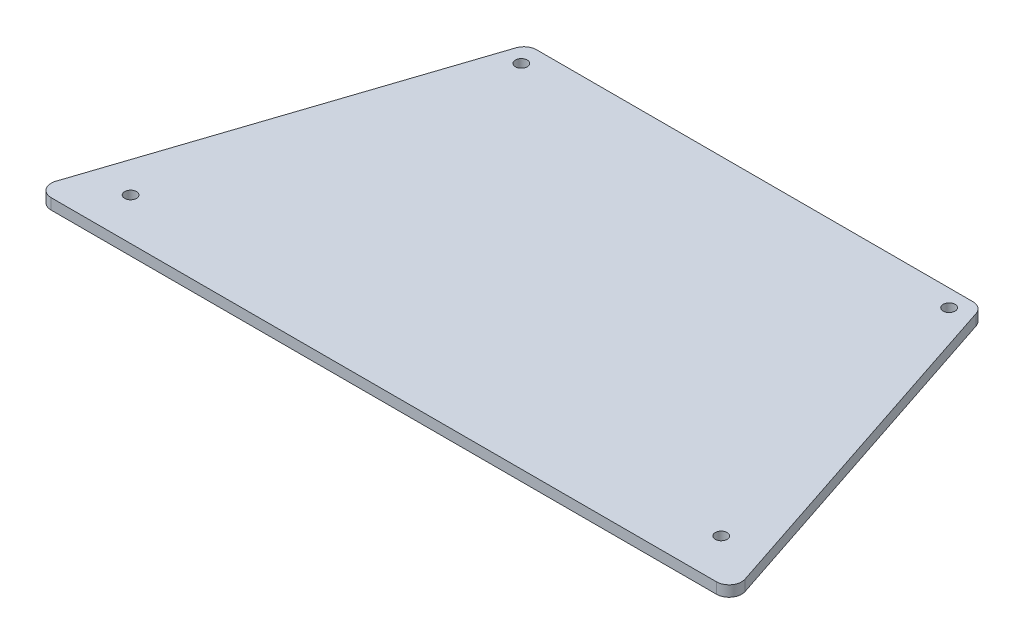
from build123d import *

# Parameters (mm, degrees)
BASE_FLANGE1_DEPTH = 3
SKETCH23_R         = 1.65
CUT_EXTRUDE3_DEPTH = 3


# Sheet-metal steps are written as plain solids
with BuildPart() as part:
    # Sketch1 → Base-Flange1 (new body)
    with BuildSketch(Plane(origin=(0, 0, 0), x_dir=(1, 0, 0), z_dir=(0, 1, 0))):
        with BuildLine():
            Line((-63.892333426, 101.078420902), (-95.697333426, 5.100954406))
            ThreePointArc((-95.697333426, 5.100954406), (-95.212546513, 1.951017377), (-92.375, 0.5))
            Line((-92.375, 0.5), (92.375, 0.5))
            ThreePointArc((92.375, 0.5), (95.212546513, 1.951017377), (95.697333426, 5.100954406))
            Line((95.697333426, 5.100954406), (63.892333426, 101.078420902))
            ThreePointArc((63.892333426, 101.078420902), (62.618982623, 102.815013009), (60.57, 103.477466496))
            Line((60.57, 103.477466496), (-60.57, 103.477466496))
            ThreePointArc((-60.57, 103.477466496), (-62.618982623, 102.815013009), (-63.892333426, 101.078420902))
        make_face()
    extrude(amount=-BASE_FLANGE1_DEPTH)

    # Sketch23 → Cut-Extrude3 (cut)
    with BuildSketch(Plane.XZ.offset(3)):
        with Locations(Location((-82, -12.182416465, 0), (0, 0, 270))):
            Circle(SKETCH23_R)
        with Locations(Location((82, -12.182416465, 0), (0, 0, 270))):
            Circle(SKETCH23_R)
        with Locations(Location((58.757797989, -98.719801772, 0), (0, 0, 270))):
            Circle(SKETCH23_R)
        with Locations(Location((-59.392713729, -98.076633575, 0), (0, 0, 270))):
            Circle(SKETCH23_R)
    extrude(amount=-CUT_EXTRUDE3_DEPTH, mode=Mode.SUBTRACT)


solid = part.part
